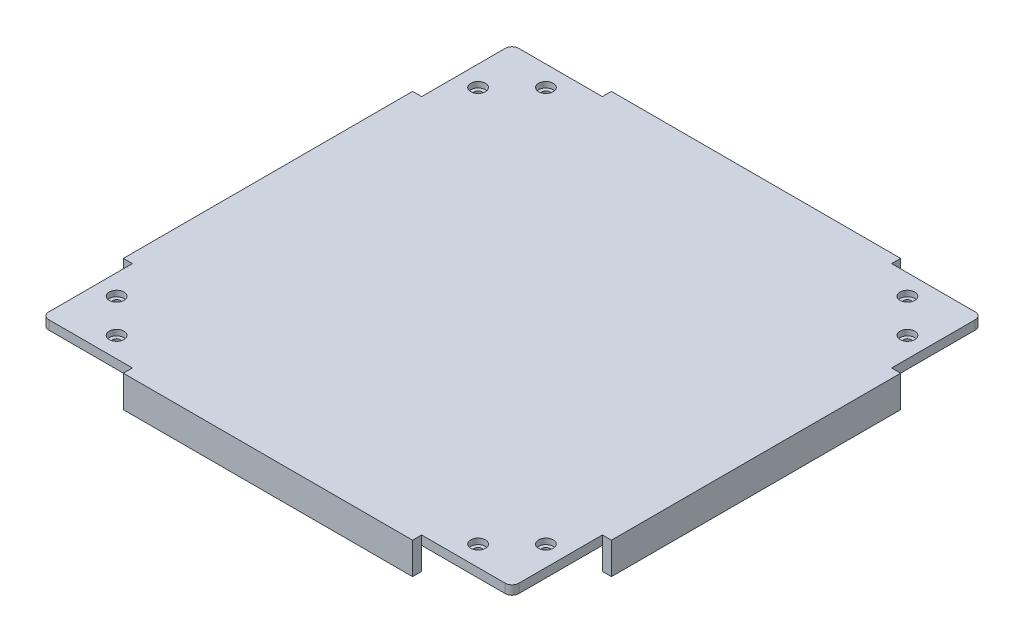
from build123d import *

# Parameters (mm, degrees)
SKETCH1_W                              = 208
SKETCH1_H                              = 208
BASE_PLATE_DEPTH                       = 4
MOUNTING_HOLES_START                   = 1.5
MOUNTING_HOLES_OUTLINE_R               = 3.25
MOUNTING_HOLES_DEPTH                   = 2.5
MOUNTING_HOLES_2_OUTLINE_R             = 1.7
MOUNTING_HOLES_2_DEPTH                 = 1.5
MOUNTING_HOLES_MIRROR2_START           = 1.5
MOUNTING_HOLES_MIRROR2_COPY_1_SKETCH_R = 3.25
MOUNTING_HOLES_MIRROR2_COPY_1_DEPTH    = 2.5
MOUNTING_HOLES_MIRROR2_COPY_2_SKETCH_R = 1.7
MOUNTING_HOLES_MIRROR2_COPY_2_DEPTH    = 1.5
MOUNTING_HOLES_MIRROR2_COPY_3_SKETCH_R = 1.7
MOUNTING_HOLES_MIRROR2_COPY_3_DEPTH    = 1.5
SKETCH5_W                              = 128
SKETCH5_H                              = 4
SIDE_EXTRUSION_DEPTH                   = 14
SIDE_EXTRUSION_MIRROR2_COPY_1_SKETCH_W = 128
SIDE_EXTRUSION_MIRROR2_COPY_1_SKETCH_H = 4
SIDE_EXTRUSION_MIRROR2_COPY_1_DEPTH    = 14
EDGE_FILLETS_R                         = 3


# Read off the part's stored shape, not the designer's step: mounting_holes
with BuildPart() as part:
    # Sketch1 → base_plate (new body)
    with BuildSketch(Plane(origin=(0, 0, 0), x_dir=(1, 0, 0), z_dir=(0, 1, 0))):
        Rectangle(SKETCH1_W, SKETCH1_H)
    extrude(amount=BASE_PLATE_DEPTH)

    # mounting_holes outline → mounting_holes (cut)
    with BuildSketch(Plane(origin=(0, 0, 0), x_dir=(1, 0, 0), z_dir=(0, 1, 0)).offset(MOUNTING_HOLES_START)):
        with Locations((95, 80)):
            Circle(MOUNTING_HOLES_OUTLINE_R)
        with Locations((80, 95)):
            Circle(MOUNTING_HOLES_OUTLINE_R)
    mounting_holes = extrude(amount=MOUNTING_HOLES_DEPTH, mode=Mode.SUBTRACT)

    # mounting_holes 2 outline → mounting_holes 2 (cut)
    with BuildSketch(Plane(origin=(0, 0, 0), x_dir=(1, 0, 0), z_dir=(0, 1, 0))):
        with Locations((95, 80)):
            Circle(MOUNTING_HOLES_2_OUTLINE_R)
        with Locations((80, 95)):
            Circle(MOUNTING_HOLES_2_OUTLINE_R)
    mounting_holes_2 = extrude(amount=MOUNTING_HOLES_2_DEPTH, mode=Mode.SUBTRACT)

    # mounting_holes_mirror1: mounting_holes, mounting_holes 2 across plane
    add(mounting_holes.mirror(Plane.XY), mode=Mode.SUBTRACT)
    add(mounting_holes_2.mirror(Plane.XY), mode=Mode.SUBTRACT)

    # mounting_holes_mirror2: mounting_holes, mounting_holes 2 across plane
    add(mounting_holes.mirror(Plane(origin=(0, 0, 0), x_dir=(0, 0, 1), z_dir=(1, 0, 0))), mode=Mode.SUBTRACT)
    add(mounting_holes_2.mirror(Plane(origin=(0, 0, 0), x_dir=(0, 0, 1), z_dir=(1, 0, 0))), mode=Mode.SUBTRACT)

    # mounting_holes_mirror2 copy 1 sketch → mounting_holes_mirror2 copy 1 (cut)
    with BuildSketch(Plane(origin=(0, 0, 0), x_dir=(-1, 0, 0), z_dir=(0, 1, 0)).offset(MOUNTING_HOLES_MIRROR2_START)):
        with Locations((95, 80)):
            Circle(MOUNTING_HOLES_MIRROR2_COPY_1_SKETCH_R)
        with Locations((80, 95)):
            Circle(MOUNTING_HOLES_MIRROR2_COPY_1_SKETCH_R)
    extrude(amount=MOUNTING_HOLES_MIRROR2_COPY_1_DEPTH, mode=Mode.SUBTRACT)

    # mounting_holes_mirror2 copy 2 sketch → mounting_holes_mirror2 copy 2 (cut)
    with BuildSketch(Plane(origin=(0, 0, 0), x_dir=(-1, 0, 0), z_dir=(0, 1, 0))):
        with Locations((95, 80)):
            Circle(MOUNTING_HOLES_MIRROR2_COPY_2_SKETCH_R)
        with Locations((80, 95)):
            Circle(MOUNTING_HOLES_MIRROR2_COPY_2_SKETCH_R)
    extrude(amount=MOUNTING_HOLES_MIRROR2_COPY_2_DEPTH, mode=Mode.SUBTRACT)

    # mounting_holes_mirror2 copy 3 sketch → mounting_holes_mirror2 copy 3 (cut)
    with BuildSketch(Plane(origin=(0, 0, 0), x_dir=(-1, 0, 0), z_dir=(0, 1, 0))):
        with Locations((95, -80)):
            Circle(MOUNTING_HOLES_MIRROR2_COPY_3_SKETCH_R)
        with Locations((80, -95)):
            Circle(MOUNTING_HOLES_MIRROR2_COPY_3_SKETCH_R)
    extrude(amount=MOUNTING_HOLES_MIRROR2_COPY_3_DEPTH, mode=Mode.SUBTRACT)

    # Sketch5 → side_extrusion (add)
    with BuildSketch(Plane(origin=(0, 4, 0), x_dir=(1, 0, 0), z_dir=(0, 1, 0))):
        with Locations((0, 106)):
            Rectangle(SKETCH5_W, SKETCH5_H)
    side_extrusion = extrude(amount=-SIDE_EXTRUSION_DEPTH)

    # side_extrusion_mirror1: side_extrusion across plane
    add(side_extrusion.mirror(Plane(origin=(0, 0, 0), x_dir=(0.7071067811865476, 0, 0.7071067811865476), z_dir=(0.7071067811865477, 0, -0.7071067811865475))))

    # side_extrusion_mirror2: side_extrusion across plane
    add(side_extrusion.mirror(Plane(origin=(0, 0, 0), x_dir=(-0.7071067811865476, 0, 0.7071067811865476), z_dir=(0.7071067811865477, 0, 0.7071067811865475))))

    # side_extrusion_mirror2 copy 1 sketch → side_extrusion_mirror2 copy 1 (add)
    with BuildSketch(Plane(origin=(0, 4, 0), x_dir=(-1, 0, 0), z_dir=(0, 1, 0))):
        with Locations((0, 106)):
            Rectangle(SIDE_EXTRUSION_MIRROR2_COPY_1_SKETCH_W, SIDE_EXTRUSION_MIRROR2_COPY_1_SKETCH_H)
    extrude(amount=-SIDE_EXTRUSION_MIRROR2_COPY_1_DEPTH)

    # edge_fillets
    edge_fillets_edges = [part.edges().sort_by_distance(p)[0] for p in [
        (104, 2, 104),
        (-104, 2, 104),
        (-104, 2, -104),
        (104, 2, -104),
    ]]
    fillet(edge_fillets_edges, radius=EDGE_FILLETS_R)


solid = part.part
